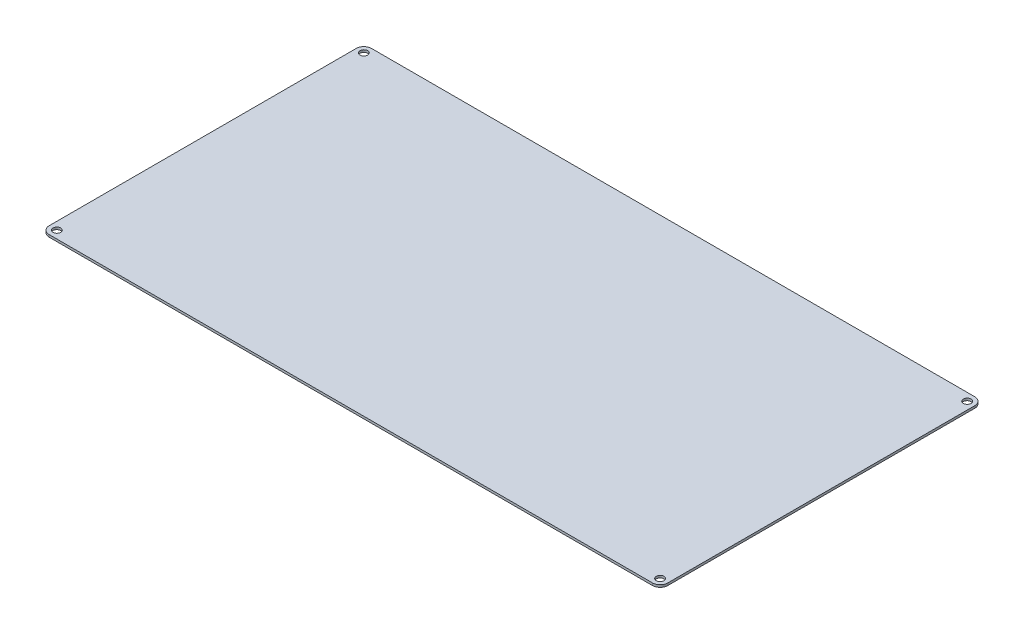
from build123d import *

# Parameters (mm, degrees)
SKETCH1_R          = 2.5
BASE_FLANGE1_DEPTH = 1.5


# Sheet-metal steps are written as plain solids
with BuildPart() as part:
    # Sketch1 → Base-Flange1 (new body)
    with BuildSketch(Plane(origin=(0, 0, 0), x_dir=(1, 0, 0), z_dir=(0, 1, 0))):
        with BuildLine():
            Line((5, 0), (398, 0))
            ThreePointArc((398, 0), (401.535533906, 1.464466094), (403, 5))
            Line((403, 5), (403, 205))
            ThreePointArc((403, 205), (401.535533906, 208.535533906), (398, 210))
            Line((398, 210), (5, 210))
            ThreePointArc((5, 210), (1.464466094, 208.535533906), (0, 205))
            Line((0, 205), (0, 5))
            ThreePointArc((0, 5), (1.464466094, 1.464466094), (5, 0))
        make_face()
        with Locations(Location((5, 205, 0), (0, 0, 270))):
            Circle(SKETCH1_R, mode=Mode.SUBTRACT)
        with Locations(Location((5, 5, 0), (0, 0, 270))):
            Circle(SKETCH1_R, mode=Mode.SUBTRACT)
        with Locations(Location((398, 5, 0), (0, 0, 270))):
            Circle(SKETCH1_R, mode=Mode.SUBTRACT)
        with Locations(Location((398, 205, 0), (0, 0, 270))):
            Circle(SKETCH1_R, mode=Mode.SUBTRACT)
    extrude(amount=-BASE_FLANGE1_DEPTH)


solid = part.part
